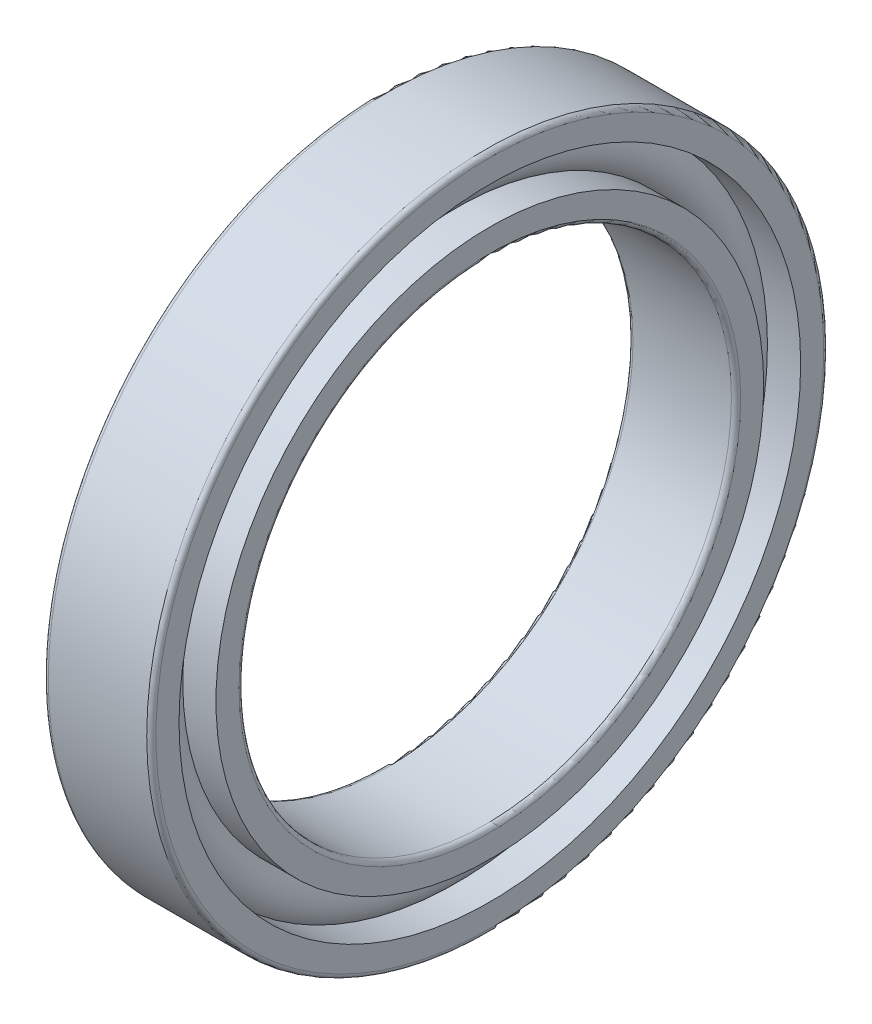
from build123d import *

# Parameters (mm, degrees)
CAGSPISKE_W     = 0.36
CAGSPISKE_H     = 0.6
CAGESPINE_ANGLE = 0.001
BALSIMSKE_R     = 1.8


with BuildPart() as part:
    # CagSpiSke → CageSpine (revolve)
    with BuildSketch(Plane.XY):
        with Locations((0, 19)):
            Rectangle(CAGSPISKE_W, CAGSPISKE_H)
    revolve(axis=Axis((-20.6375, 0, 0), (-1, 0, 0)), revolution_arc=CAGESPINE_ANGLE)

    # BalSimSke → BallsSimplified (revolve)
    with BuildSketch(Plane.XY):
        with Locations((0, 19)):
            Circle(BALSIMSKE_R)
    revolve(axis=Axis((-10, 0, 0), (1, 0, 0)))

    # InnRacSke → InnerRace (revolve)
    with BuildSketch(Plane.XY):
        with BuildLine():
            Line((-1.307908636, 17.8), (-3.5, 17.8))
            Line((-3.5, 17.8), (-3.5, 16.3))
            ThreePointArc((-3.5, 16.3), (-3.412132034, 16.087867966), (-3.2, 16))
            Line((-3.2, 16), (3.2, 16))
            ThreePointArc((3.2, 16), (3.412132034, 16.087867966), (3.5, 16.3))
            Line((3.5, 16.3), (3.5, 17.8))
            Line((3.5, 17.8), (1.307908636, 17.8))
            ThreePointArc((1.307908636, 17.8), (0, 17.225), (-1.307908636, 17.8))
        make_face()
    revolve(axis=Axis((-20.6375, 0, 0), (1, 0, 0)))

    # OutRacSke → OuterRace (revolve)
    with BuildSketch(Plane.XY):
        with BuildLine():
            Line((-1.307908636, 20.2), (-3.5, 20.2))
            Line((-3.5, 20.2), (-3.5, 21.7))
            ThreePointArc((-3.5, 21.7), (-3.412132034, 21.912132034), (-3.2, 22))
            Line((-3.2, 22), (3.2, 22))
            ThreePointArc((3.2, 22), (3.412132034, 21.912132034), (3.5, 21.7))
            Line((3.5, 21.7), (3.5, 20.2))
            Line((3.5, 20.2), (1.307908636, 20.2))
            ThreePointArc((1.307908636, 20.2), (0, 20.775), (-1.307908636, 20.2))
        make_face()
    revolve(axis=Axis((-20.6375, 0, 0), (1, 0, 0)))


solid = part.part
